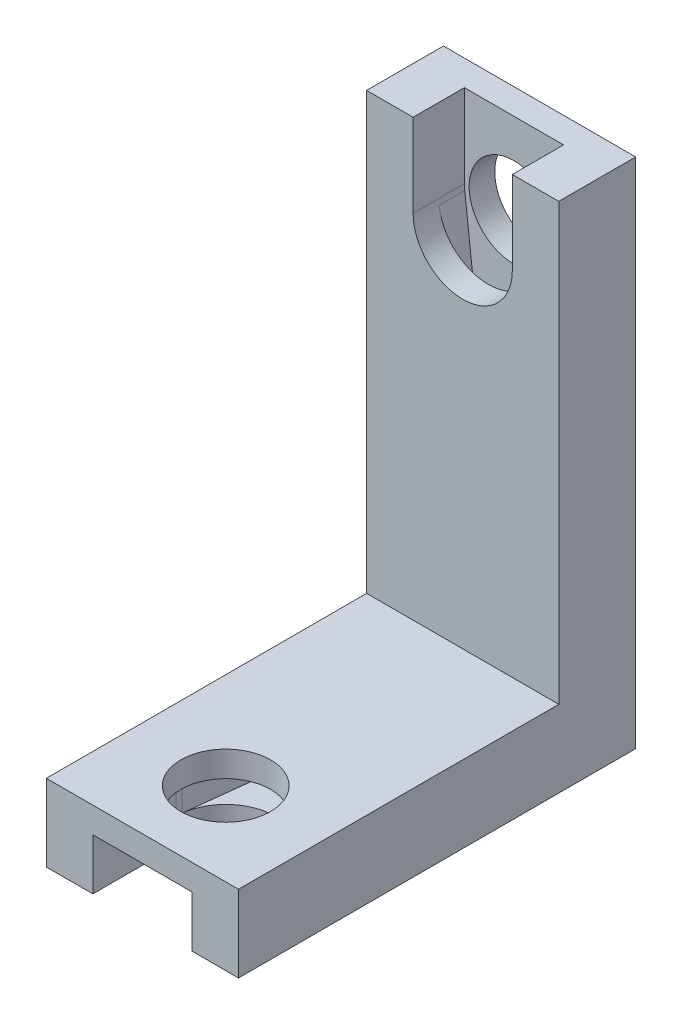
from build123d import *

# Parameters (mm, degrees)
BOSS_EXTRUDE1_DEPTH = 7.5
SKETCH2_R           = 3.5
CUT_EXTRUDE1_DEPTH  = 43.041646019
CUT_EXTRUDE2_DEPTH  = 1
CUT_EXTRUDE3_DEPTH  = 43.041646019
SKETCH6_R           = 3.5
CUT_EXTRUDE4_DEPTH  = 48.002659499
CUT_EXTRUDE5_DEPTH  = 1
CUT_EXTRUDE6_DEPTH  = 48.605146781


with BuildPart() as part:
    # Sketch1 → Boss-Extrude1 (new, symmetric)
    with BuildSketch(Plane(origin=(0, 0, 0), x_dir=(0, 0, -1), z_dir=(1, 0, 0))):
        Polygon((-12.5, -3), (-12.5, 3), (12.5, 3), (12.5, 37), (18.5, 37), (18.5, -3), align=None)
    extrude(amount=BOSS_EXTRUDE1_DEPTH, both=True)

    # Sketch2 → Cut-Extrude1 (cut, through all)
    with BuildSketch(Plane(origin=(0, 0, 0), x_dir=(1, 0, 0), z_dir=(0, 1, 0))):
        with Locations((0, -6)):
            Circle(SKETCH2_R)
    extrude(amount=CUT_EXTRUDE1_DEPTH, mode=Mode.SUBTRACT)

    # Sketch3 → Cut-Extrude2 (cut, symmetric)
    with BuildSketch(Plane(origin=(0, 0, 0), x_dir=(1, 0, 0), z_dir=(0, 1, 0))):
        with BuildLine():
            Line((3.84429899, -5.554730114), (2.235057553, 8.338877841))
            ThreePointArc((2.235057553, 8.338877841), (0, 10.33), (-2.235057553, 8.338877841))
            Line((-2.235057553, 8.338877841), (-3.84429899, -5.554730114))
            ThreePointArc((-3.84429899, -5.554730114), (-3.863569405, -5.776994499), (-3.87, -6))
            Line((-3.87, -6), (-3.87, -12.5))
            Line((-3.87, -12.5), (3.87, -12.5))
            Line((3.87, -12.5), (3.87, -6))
            ThreePointArc((3.87, -6), (3.863569405, -5.776994499), (3.84429899, -5.554730114))
        make_face()
    extrude(amount=CUT_EXTRUDE2_DEPTH, both=True, mode=Mode.SUBTRACT)

    # Sketch4 → Cut-Extrude3 (cut, through all)
    with BuildSketch(Plane(origin=(0, 0, 0), x_dir=(1, 0, 0), z_dir=(0, 1, 0))):
        with BuildLine():
            Line((-3.87, -6), (-3.87, -12.5))
            Line((-3.87, -12.5), (3.87, -12.5))
            Line((3.87, -12.5), (3.87, -6))
            ThreePointArc((3.87, -6), (0, -2.13), (-3.87, -6))
        make_face()
    extrude(amount=-CUT_EXTRUDE3_DEPTH, mode=Mode.SUBTRACT)

    # Sketch6 → Cut-Extrude4 (cut, through all)
    with BuildSketch(Plane.XY.offset(-15.5)):
        with Locations((0, 30.5)):
            Circle(SKETCH6_R)
    extrude(amount=-CUT_EXTRUDE4_DEPTH, mode=Mode.SUBTRACT)

    # Sketch7 → Cut-Extrude5 (cut, symmetric)
    with BuildSketch(Plane.XY.offset(-15.5)):
        with BuildLine():
            Line((2.235057553, 16.161122159), (3.84429899, 30.054730114))
            ThreePointArc((3.84429899, 30.054730114), (3.863569405, 30.276994499), (3.87, 30.5))
            Line((3.87, 30.5), (3.87, 37))
            Line((3.87, 37), (-3.87, 37))
            Line((-3.87, 37), (-3.87, 30.5))
            ThreePointArc((-3.87, 30.5), (-3.863569405, 30.276994499), (-3.84429899, 30.054730114))
            Line((-3.84429899, 30.054730114), (-2.235057553, 16.161122159))
            ThreePointArc((-2.235057553, 16.161122159), (0, 14.17), (2.235057553, 16.161122159))
        make_face()
    extrude(amount=CUT_EXTRUDE5_DEPTH, both=True, mode=Mode.SUBTRACT)

    # Sketch8 → Cut-Extrude6 (cut, through all)
    with BuildSketch(Plane.XY.offset(-16.5)):
        with BuildLine():
            Line((3.87, 30.5), (3.87, 37))
            Line((3.87, 37), (-3.87, 37))
            Line((-3.87, 37), (-3.87, 30.5))
            ThreePointArc((-3.87, 30.5), (0, 26.63), (3.87, 30.5))
        make_face()
    extrude(amount=CUT_EXTRUDE6_DEPTH, mode=Mode.SUBTRACT)


solid = part.part
